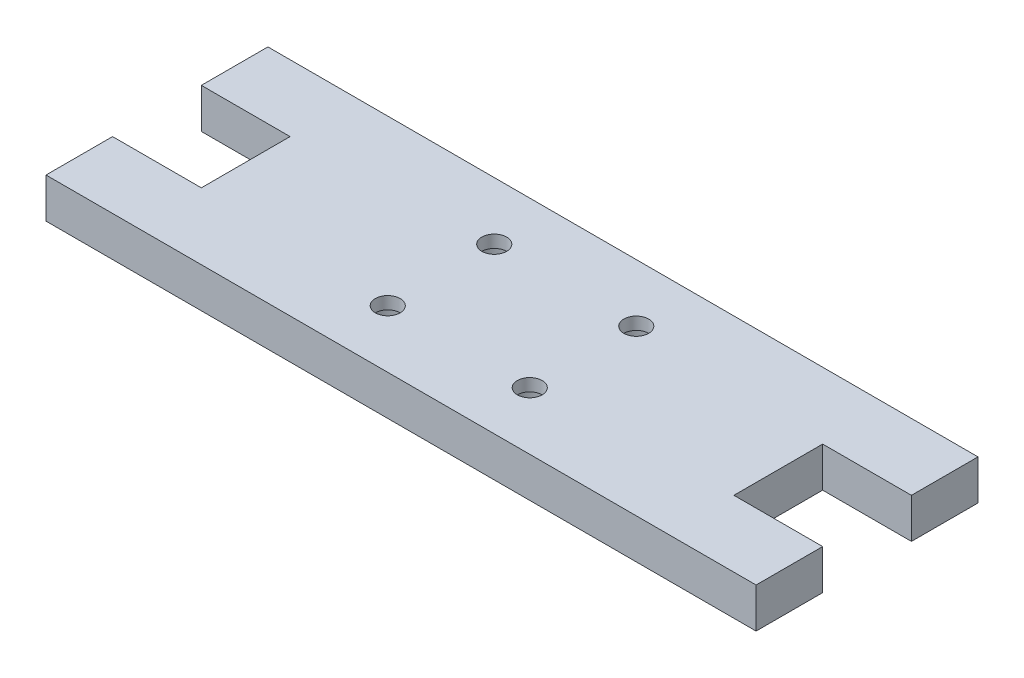
from build123d import *

# Parameters (mm, degrees)
SKETCH1_W                       = 25
SKETCH1_H                       = 4.5
BOSS_EXTRUDE1_DEPTH             = 30
SKETCH2_W                       = 7.5
SKETCH2_H                       = 4.5
BOSS_EXTRUDE2_DEPTH             = 10
CBORE_FOR_M3_SBHCS2_D           = 2.8
CBORE_FOR_M3_SBHCS2_CBORE_D     = 5.5
CBORE_FOR_M3_SBHCS2_CBORE_DEPTH = 3.1


with BuildPart() as part:
    # Sketch1 → Boss-Extrude1 (new, symmetric)
    with BuildSketch(Plane(origin=(0, 0, 0), x_dir=(0, 0, -1), z_dir=(1, 0, 0))):
        Rectangle(SKETCH1_W, SKETCH1_H)
    extrude(amount=BOSS_EXTRUDE1_DEPTH, both=True)

    # Sketch2 → Boss-Extrude2 (add)
    with BuildSketch(Plane(origin=(30, 0, 0), x_dir=(0, 0, -1), z_dir=(1, 0, 0))):
        with Locations((-8.75, 0)):
            Rectangle(SKETCH2_W, SKETCH2_H)
        with Locations((8.75, 0)):
            Rectangle(SKETCH2_W, SKETCH2_H)
    boss_extrude2 = extrude(amount=BOSS_EXTRUDE2_DEPTH)

    # Mirror1: Boss-Extrude2 across plane
    add(boss_extrude2.mirror(Plane(origin=(0, 0, 0), x_dir=(0, 0, 1), z_dir=(1, 0, 0))))

    # CBORE for M3 SBHCS2 (through all)
    with Locations(Plane(origin=(0, -2.25, 0), x_dir=(-1, 0, 0), z_dir=(0, -1, 0))):
        with Locations((-8, 6), (8, 6), (8, -6), (-8, -6)):
            CounterBoreHole(CBORE_FOR_M3_SBHCS2_D / 2, CBORE_FOR_M3_SBHCS2_CBORE_D / 2, CBORE_FOR_M3_SBHCS2_CBORE_DEPTH)


solid = part.part
